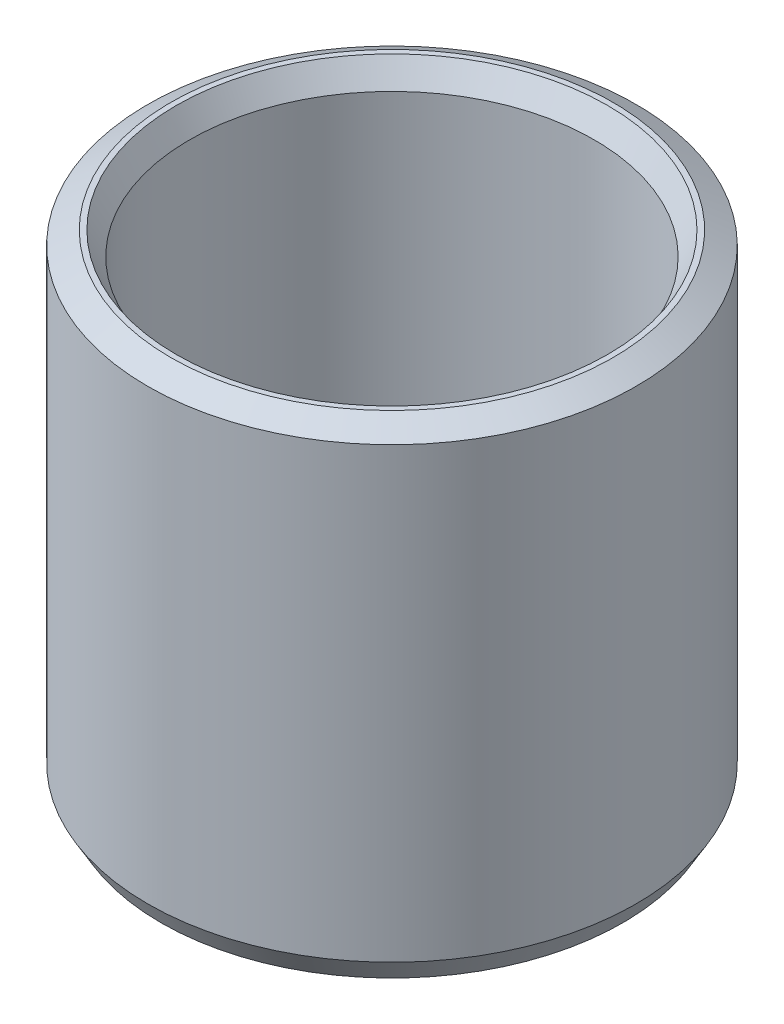
from build123d import *
from OCP.BRepFilletAPI import BRepFilletAPI_MakeChamfer

# Parameters (mm, degrees)
SKETCH1_R           = 32.5
BOSS_EXTRUDE1_DEPTH = 64.499466306
SKETCH2_R           = 26.936338737
CUT_EXTRUDE1_DEPTH  = 80.200259808
CHAMFER1_SIZE       = 1.773556605
CHAMFER1_SIZE2      = 3.07189015


with BuildPart() as part:
    # Sketch1 → Boss-Extrude1 (new body)
    with BuildSketch(Plane(origin=(0, 0, 0), x_dir=(1, 0, 0), z_dir=(0, 1, 0))):
        Circle(SKETCH1_R)
    extrude(amount=BOSS_EXTRUDE1_DEPTH)

    # Sketch2 → Cut-Extrude1 (cut, through all)
    with BuildSketch(Plane(origin=(0, 0, 0), x_dir=(1, 0, 0), z_dir=(0, 1, 0))):
        Circle(SKETCH2_R)
    extrude(amount=CUT_EXTRUDE1_DEPTH, mode=Mode.SUBTRACT)

    # Chamfer1: one chamfer whose edges measure the first distance from different faces: ONE call of the kernel's chamfer builder (chamfer() names one face for all edges)
    chamfer1_edges_1 = [part.edges().sort_by_distance(p)[0] for p in [
        (-26.936338737, 64.499466306, 0),
    ]]
    chamfer1_side_1 = [part.faces().sort_by_distance(p)[0] for p in [
        (-31.580761184, 64.499466306, 0),
    ]]
    chamfer1_edges_2 = [part.edges().sort_by_distance(p)[0] for p in [
        (-26.936338737, 0, 0),
    ]]
    chamfer1_side_2 = [part.faces().sort_by_distance(p)[0] for p in [
        (-26.936338737, 32.249733153, 0),
    ]]
    chamfer1_edges_3 = [part.edges().sort_by_distance(p)[0] for p in [
        (-32.5, 0, 0),
    ]]
    chamfer1_side_3 = [part.faces().sort_by_distance(p)[0] for p in [
        (-31.580761184, 0, 0),
    ]]
    chamfer1_edges_4 = [part.edges().sort_by_distance(p)[0] for p in [
        (-32.5, 64.499466306, 0),
    ]]
    chamfer1_side_4 = [part.faces().sort_by_distance(p)[0] for p in [
        (-32.5, 32.249733153, 0),
    ]]
    chamfer1 = BRepFilletAPI_MakeChamfer(part.part.solid().wrapped)
    for e in chamfer1_edges_1:
        chamfer1.Add(CHAMFER1_SIZE, CHAMFER1_SIZE2, e.wrapped, chamfer1_side_1[0].wrapped)  # the first distance lies on this face
    for e in chamfer1_edges_2:
        chamfer1.Add(CHAMFER1_SIZE, CHAMFER1_SIZE2, e.wrapped, chamfer1_side_2[0].wrapped)  # the first distance lies on this face
    for e in chamfer1_edges_3:
        chamfer1.Add(CHAMFER1_SIZE, CHAMFER1_SIZE2, e.wrapped, chamfer1_side_3[0].wrapped)  # the first distance lies on this face
    for e in chamfer1_edges_4:
        chamfer1.Add(CHAMFER1_SIZE, CHAMFER1_SIZE2, e.wrapped, chamfer1_side_4[0].wrapped)  # the first distance lies on this face
    add(Compound.cast(chamfer1.Shape()), mode=Mode.REPLACE)


solid = part.part
